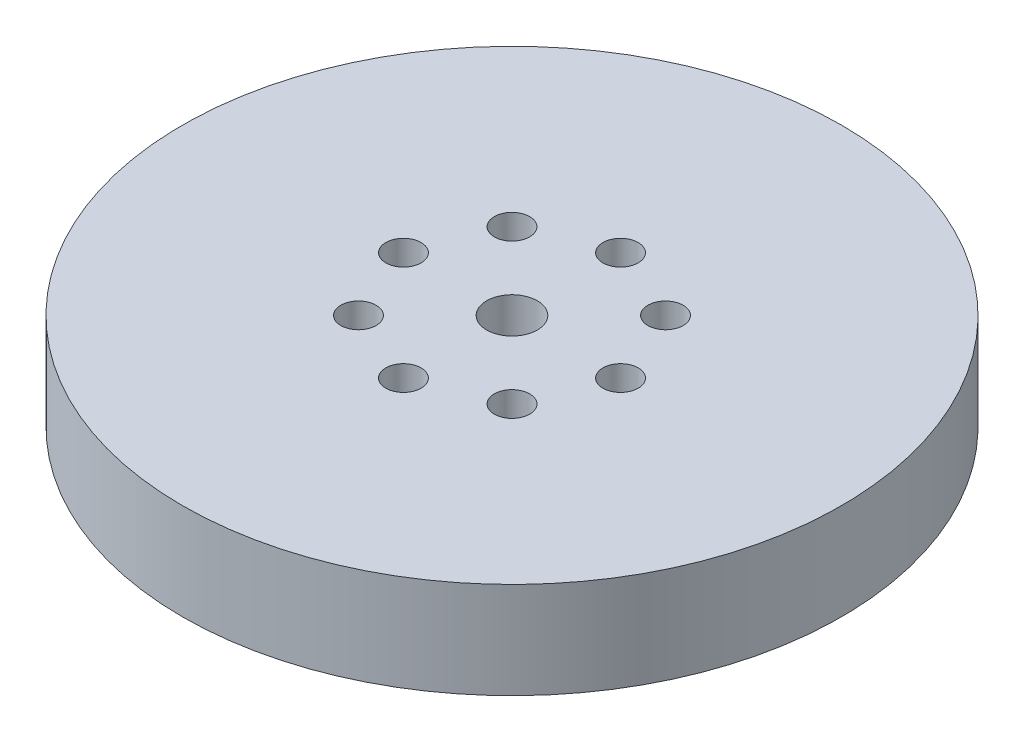
from build123d import *

# Parameters (mm, degrees)
SKETCH1_R           = 65
BOSS_EXTRUDE1_DEPTH = 19
SKETCH2_R           = 5
CUT_EXTRUDE1_DEPTH  = 94.866927083
SKETCH3_R           = 3.479573806
CUT_EXTRUDE2_DEPTH  = 11.750950787
CIRPATTERN1_COUNT   = 8


with BuildPart() as part:
    # Sketch1 → Boss-Extrude1 (new body)
    with BuildSketch(Plane(origin=(0, 0, 0), x_dir=(1, 0, 0), z_dir=(0, 1, 0))):
        Circle(SKETCH1_R)
    extrude(amount=BOSS_EXTRUDE1_DEPTH)

    # Sketch2 → Cut-Extrude1 (cut, through all)
    with BuildSketch(Plane(origin=(0, 0, 0), x_dir=(1, 0, 0), z_dir=(0, 1, 0))):
        Circle(SKETCH2_R)
    extrude(amount=CUT_EXTRUDE1_DEPTH, mode=Mode.SUBTRACT)

    # Sketch3 → Cut-Extrude2 (cut)
    with BuildSketch(Plane(origin=(0, 19, 0), x_dir=(1, 0, 0), z_dir=(0, 1, 0))):
        with Locations((-21.40993498, 0)):
            Circle(SKETCH3_R)
    cut_extrude2 = extrude(amount=-CUT_EXTRUDE2_DEPTH, mode=Mode.SUBTRACT)

    # CirPattern1: Cut-Extrude2 ×8 about axis
    cirpattern1_axis = Axis((0, 0, 0), (0, 1, 0))
    for i in range(1, CIRPATTERN1_COUNT):
        add(cut_extrude2.rotate(cirpattern1_axis, i * 360 / CIRPATTERN1_COUNT), mode=Mode.SUBTRACT)


solid = part.part
